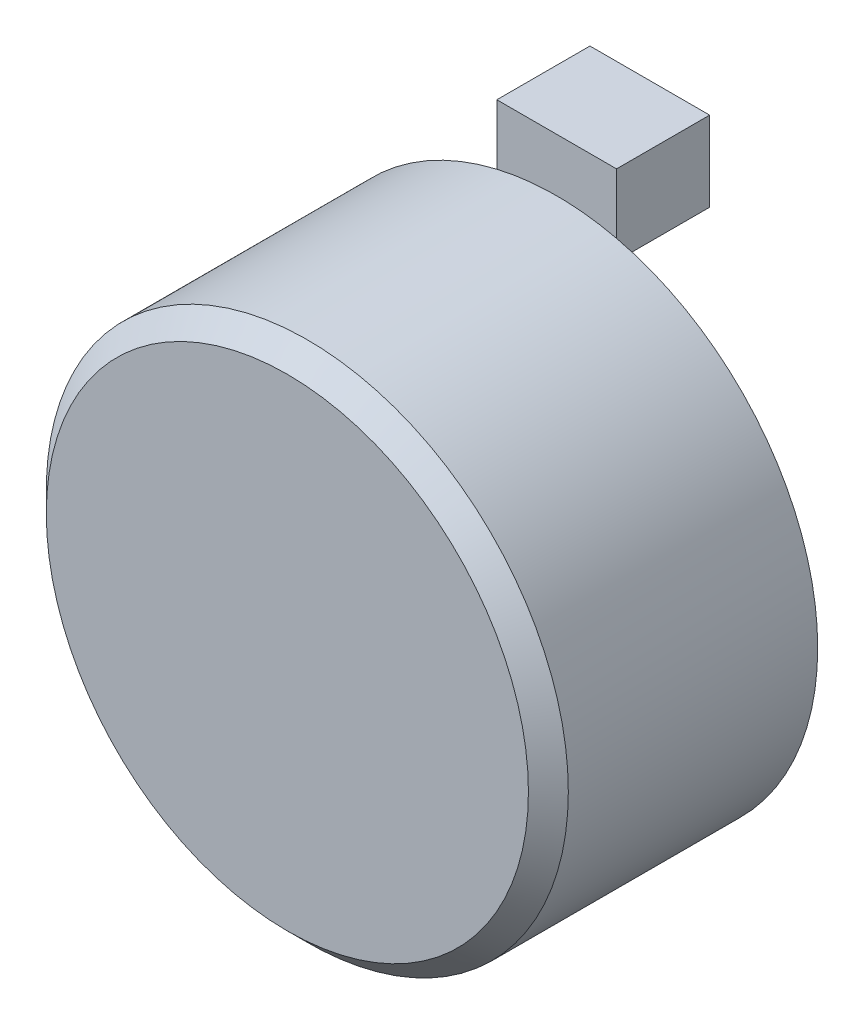
from build123d import *

# Parameters (mm, degrees)
SK_REARHOLE_R           = 1.25
REAR_TAPPED_HOLE_DEPTH  = 8
REAR_HOLE_PATTERN_COUNT = 6
SK_CONNECTOR_W          = 18
SK_CONNECTOR_H          = 12
CONNECTOR_ZONE_DEPTH    = 14


with BuildPart() as part:
    # SK_Body → Housing_Body (revolve)
    with BuildSketch(Plane(origin=(0, 0, 0), x_dir=(1, 0, 0), z_dir=(0, 1, 0))):
        Polygon((0, 0), (36.25, 0), (39.25, 3), (39.25, 40.5), (36.25, 40.5), (0, 40.5), align=None)
    revolve(axis=Axis((0, 0, 10), (0, 0, -1)))

    # SK_RearHole → Rear_Tapped_Hole (cut)
    with BuildSketch(Plane.XY.offset(-40.5)):
        with Locations((33, 0)):
            Circle(SK_REARHOLE_R)
    rear_tapped_hole = extrude(amount=REAR_TAPPED_HOLE_DEPTH, mode=Mode.SUBTRACT)

    # Rear_Hole_Pattern: Rear_Tapped_Hole ×6 about axis
    rear_hole_pattern_axis = Axis((0, 0, -57.225), (0, 0, 1))
    for i in range(1, REAR_HOLE_PATTERN_COUNT):
        add(rear_tapped_hole.rotate(rear_hole_pattern_axis, i * 360 / REAR_HOLE_PATTERN_COUNT), mode=Mode.SUBTRACT)

    # SK_Connector → Connector_Zone (add)
    with BuildSketch(Plane.XY.offset(-40.5)):
        with Locations((0, 41.25)):
            Rectangle(SK_CONNECTOR_W, SK_CONNECTOR_H)
    extrude(amount=-CONNECTOR_ZONE_DEPTH)


solid = part.part
